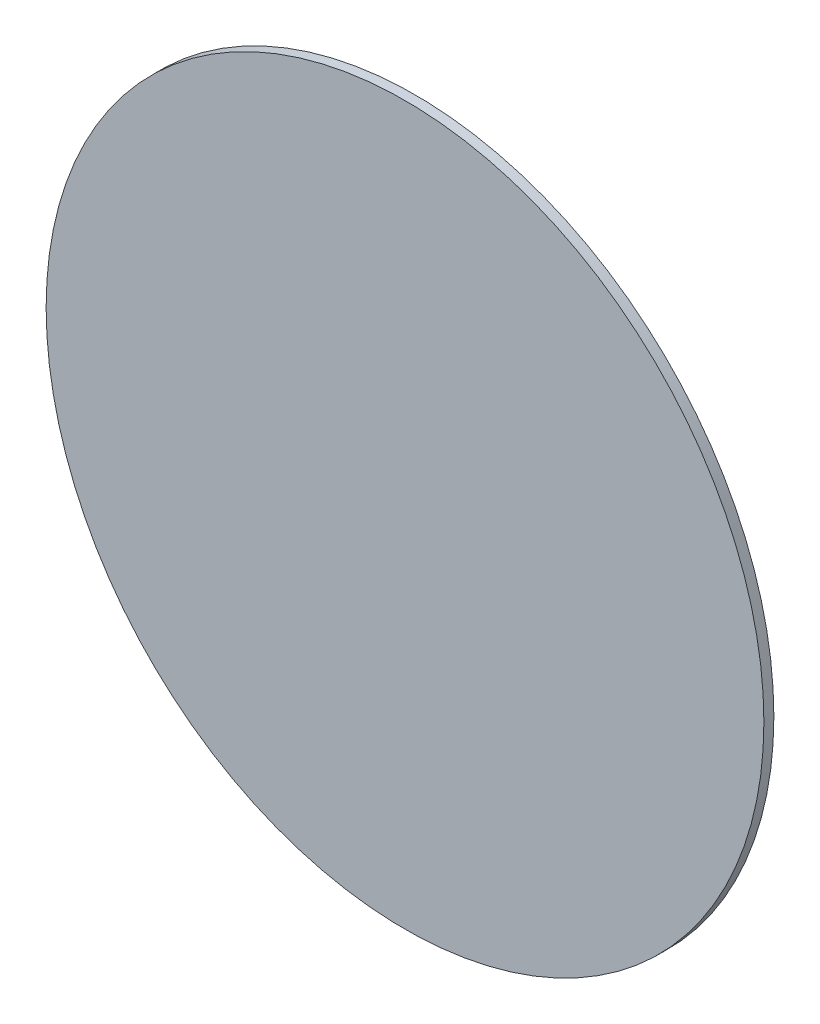
from build123d import *

# Parameters (mm, degrees)
EXTRUDE1_START = 12.7
SKETCH1_R      = 114.3
EXTRUDE1_DEPTH = 3.175


with BuildPart() as part:
    # Sketch1 → Extrude1 (new body)
    with BuildSketch(Plane.XY.offset(EXTRUDE1_START)):
        with Locations((0, 30.1625)):
            Circle(SKETCH1_R)
    extrude(amount=EXTRUDE1_DEPTH)


solid = part.part
